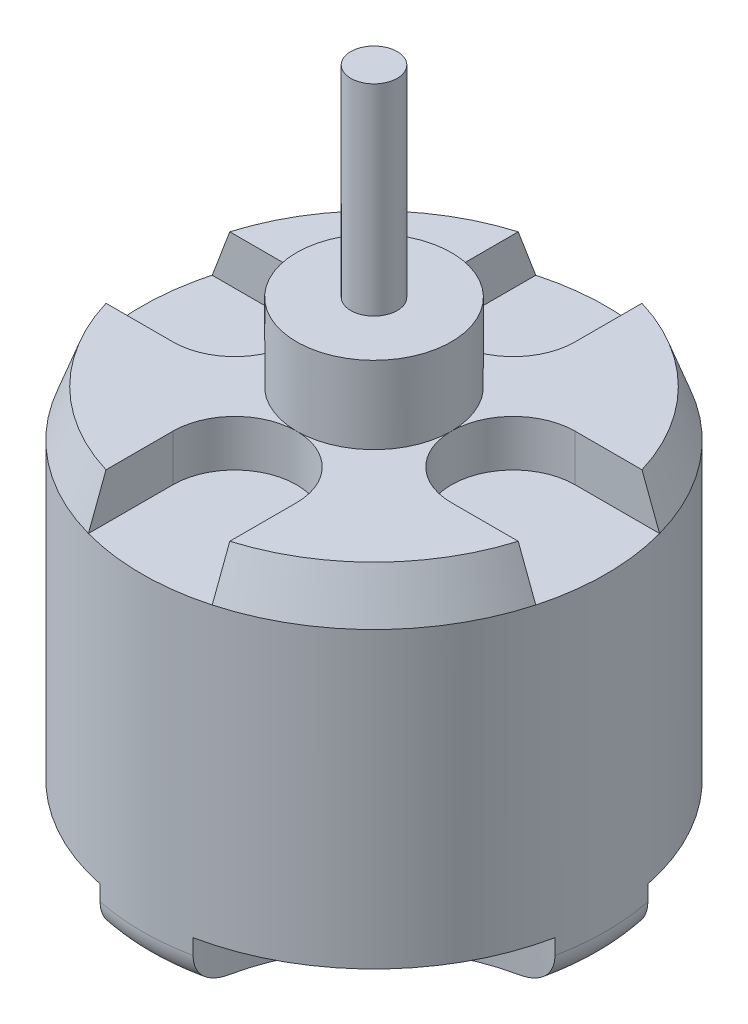
from build123d import *

# Parameters (mm, degrees)
CHANFREIN1_SIZE         = 3
CHANFREIN1_SIZE2        = 1.091910703
CONG_1_R                = 2
ENL_V_MAT_EXTRU_1_DEPTH = 3
ESQUISSE3_R             = 1.5
ENL_V_MAT_EXTRU_2_DEPTH = 3
ENL_V_START             = -1
ESQUISSE4_R             = 5
ESQUISSE4_R_2           = 1.5
ENL_V_MAT_EXTRU_3_DEPTH = 1


with BuildPart() as part:
    # Esquisse1 → Révolution1 (revolve)
    with BuildSketch(Plane.XY):
        Polygon((0, 23), (0, -20), (0, -22), (-1.5, -22), (-1.5, -20), (-15, -20), (-15, 5), (-5, 5), (-5, 10), (-1.5, 10), (-1.5, 23), align=None)
    revolve(axis=Axis((0, 23, 0), (0, -1, 0)))

    # Chanfrein1
    chanfrein1_edges = [part.edges().sort_by_distance(p)[0] for p in [
        (15, 5, 0),
    ]]
    chanfrein1_side = [part.faces().sort_by_distance(p)[0] for p in [
        (15, -7.5, 0),
    ]]
    chamfer(chanfrein1_edges, length=CHANFREIN1_SIZE, length2=CHANFREIN1_SIZE2, reference=chanfrein1_side[0])

    # Congé1
    cong_1_edges = [part.edges().sort_by_distance(p)[0] for p in [
        (15, -20, 0),
    ]]
    fillet(cong_1_edges, radius=CONG_1_R)

    # Esquisse2 → Enlèv. mat.-Extru.1 (cut)
    with BuildSketch(Plane(origin=(0, 5, 0), x_dir=(1, 0, 0), z_dir=(0, 1, 0))):
        with BuildLine():
            Line((-4, 9), (-4, 19))
            Line((-4, 19), (4, 19))
            Line((4, 19), (4, 9))
            ThreePointArc((4, 9), (0, 5), (-4, 9))
        make_face()
        with BuildLine():
            Line((9, 4), (19, 4))
            Line((19, 4), (19, -4))
            Line((19, -4), (9, -4))
            ThreePointArc((9, -4), (5, 0), (9, 4))
        make_face()
        with BuildLine():
            Line((4, -9), (4, -19))
            Line((4, -19), (-4, -19))
            Line((-4, -19), (-4, -9))
            ThreePointArc((-4, -9), (0, -5), (4, -9))
        make_face()
        with BuildLine():
            Line((-9, -4), (-19, -4))
            Line((-19, -4), (-19, 4))
            Line((-19, 4), (-9, 4))
            ThreePointArc((-9, 4), (-5, 0), (-9, -4))
        make_face()
    extrude(amount=-ENL_V_MAT_EXTRU_1_DEPTH, mode=Mode.SUBTRACT)

    # Esquisse3 → Enlèv. mat.-Extru.2 (cut)
    with BuildSketch(Plane.XZ.offset(20)):
        with Locations((0, 9)):
            Circle(ESQUISSE3_R)
        with Locations((0, -9)):
            Circle(ESQUISSE3_R)
        with Locations((9, 0)):
            Circle(ESQUISSE3_R)
        with Locations((-9, 0)):
            Circle(ESQUISSE3_R)
        with BuildLine():
            ThreePointArc((-15, 3), (-6.514718626, 6.514718626), (-3, 15))
            ThreePointArc((-3, 15), (-12.991965185, 12.991965185), (-15, 3))
        make_face()
        with BuildLine():
            ThreePointArc((3, 15), (6.514718626, 6.514718626), (15, 3))
            ThreePointArc((15, 3), (12.889510499, 12.889510499), (3, 15))
        make_face()
        with BuildLine():
            ThreePointArc((15, -3), (6.514718626, -6.514718626), (3, -15))
            ThreePointArc((3, -15), (12.652903184, -12.652903184), (15, -3))
        make_face()
        with BuildLine():
            ThreePointArc((-15, -3), (-6.514718626, -6.514718626), (-3, -15))
            ThreePointArc((-3, -15), (-12.726788918, -12.726788918), (-15, -3))
        make_face()
    extrude(amount=-ENL_V_MAT_EXTRU_2_DEPTH, mode=Mode.SUBTRACT)

    # Esquisse4 → Enlèv. mat.-Extru.3 (cut)
    with BuildSketch(Plane.XZ.offset(20).offset(ENL_V_START)):
        Circle(ESQUISSE4_R)
        Circle(ESQUISSE4_R_2, mode=Mode.SUBTRACT)
    extrude(amount=ENL_V_MAT_EXTRU_3_DEPTH, mode=Mode.SUBTRACT)


solid = part.part
